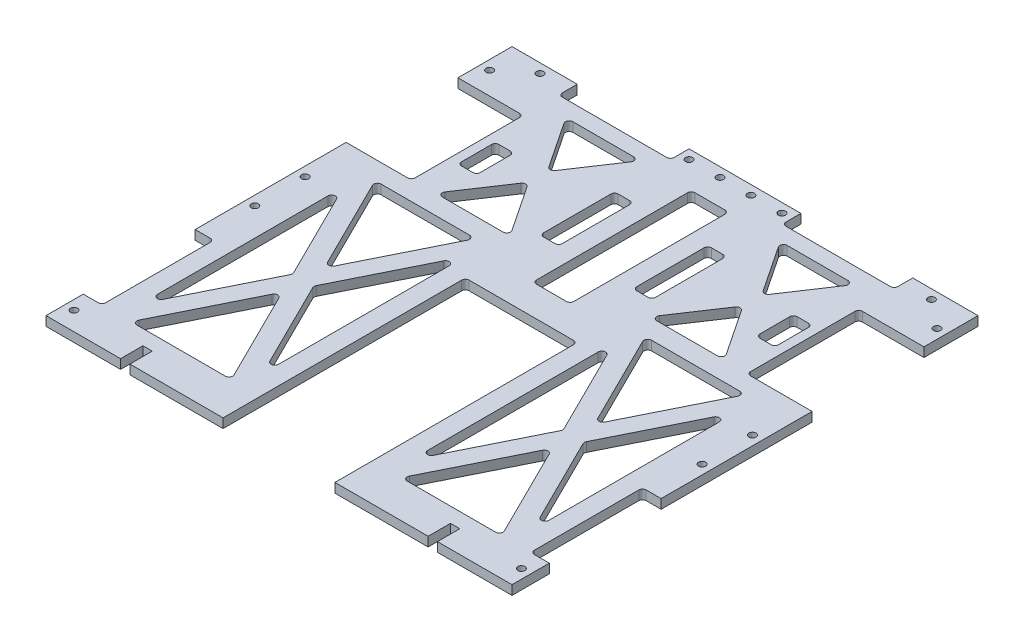
from build123d import *

# Parameters (mm, degrees)
BOSS_EXTRUDE1_DEPTH = 6.35
SKETCH2_W           = 44.45
SKETCH2_H           = 76.2
SKETCH2_W_2         = 12.7
SKETCH2_W_3         = 76.2
SKETCH2_H_2         = 12.7
CUT_EXTRUDE1_DEPTH  = 289.907554418
CUT_EXTRUDE3_DEPTH  = 289.907554418
SKETCH3_W           = 12.7
SKETCH3_H           = 50.8
SKETCH3_H_2         = 25.4
SKETCH3_W_2         = 6.35
SKETCH3_H_3         = 15.24
CUT_EXTRUDE2_DEPTH  = 289.907554418
SKETCH7_R           = 2.413
CUT_EXTRUDE6_DEPTH  = 289.907554418
SKETCH12_W          = 25.4
SKETCH12_H          = 107.95
CUT_EXTRUDE9_DEPTH  = 289.907554418
FILLET1_R           = 2.54
FILLET2_R           = 2.54
FILLET3_R           = 2.54


with BuildPart() as part:
    # Sketch1 → Boss-Extrude1 (new body)
    with BuildSketch(Plane(origin=(0, 0, 0), x_dir=(1, 0, 0), z_dir=(0, 1, 0))):
        Polygon((-158.75, 76.2), (-158.75, -241.3), (-38.1, -241.3), (-38.1, -76.2), (38.1, -76.2), (38.1, -241.3), (158.75, -241.3), (158.75, 76.2), align=None)
    extrude(amount=BOSS_EXTRUDE1_DEPTH)

    # Sketch2 → Cut-Extrude1 (cut, through all)
    with BuildSketch(Plane(origin=(0, 6.35, 0), x_dir=(1, 0, 0), z_dir=(0, 1, 0))):
        with Locations((136.525, 1.27)):
            Rectangle(SKETCH2_W, SKETCH2_H)
        with Locations((152.4, -177.8)):
            Rectangle(SKETCH2_W_2, SKETCH2_H)
        with Locations((-152.4, -177.8)):
            Rectangle(SKETCH2_W_2, SKETCH2_H)
        with Locations((-136.525, 1.27)):
            Rectangle(SKETCH2_W, SKETCH2_H)
        with Locations((-76.2, 69.85)):
            Rectangle(SKETCH2_W_3, SKETCH2_H_2)
        with Locations((76.2, 69.85)):
            Rectangle(SKETCH2_W_3, SKETCH2_H_2)
    extrude(amount=-CUT_EXTRUDE1_DEPTH, mode=Mode.SUBTRACT)

    # Sketch4 → Cut-Extrude3 (cut, through all)
    with BuildSketch(Plane(origin=(0, 6.35, 0), x_dir=(1, 0, 0), z_dir=(0, 1, 0))):
        Polygon((92.075, -147.001477117), (57.88871002, -215.9), (126.26128998, -215.9), align=None)
        Polygon((50.8, -63.816477117), (50.8, -201.613522883), (84.98628998, -132.715), align=None)
        Polygon((133.35, -63.816477117), (99.16371002, -132.715), (133.35, -201.613522883), align=None)
        Polygon((57.88871002, -49.53), (92.075, -118.428522883), (126.26128998, -49.53), align=None)
        Polygon((-84.98628998, -132.715), (-50.8, -201.613522883), (-50.8, -63.816477117), align=None)
        Polygon((-126.26128998, -49.53), (-92.075, -118.428522883), (-57.88871002, -49.53), align=None)
        Polygon((-57.88871002, -215.9), (-92.075, -147.001477117), (-126.26128998, -215.9), align=None)
        Polygon((-133.35, -201.613522883), (-99.16371002, -132.715), (-133.35, -63.816477117), align=None)
    extrude(amount=-CUT_EXTRUDE3_DEPTH, mode=Mode.SUBTRACT)

    # Sketch3 → Cut-Extrude2 (cut, through all)
    with BuildSketch(Plane(origin=(0, 6.35, 0), x_dir=(1, 0, 0), z_dir=(0, 1, 0))):
        with Locations((-31.75, 0)):
            Rectangle(SKETCH3_W, SKETCH3_H)
        with Locations((31.75, 0)):
            Rectangle(SKETCH3_W, SKETCH3_H)
        with Locations((101.6, 1.27)):
            Rectangle(SKETCH3_W, SKETCH3_H_2)
        with Locations((-101.6, 1.27)):
            Rectangle(SKETCH3_W, SKETCH3_H_2)
        with Locations((104.775, -233.68)):
            Rectangle(SKETCH3_W_2, SKETCH3_H_3)
        with Locations((-104.775, -233.68)):
            Rectangle(SKETCH3_W_2, SKETCH3_H_3)
    extrude(amount=-CUT_EXTRUDE2_DEPTH, mode=Mode.SUBTRACT)

    # Sketch7 → Cut-Extrude6 (cut, through all)
    with BuildSketch(Plane(origin=(0, 6.35, 0), x_dir=(1, 0, 0), z_dir=(0, 1, 0))):
        with Locations((152.4, -105.41)):
            Circle(SKETCH7_R)
        with Locations((152.4, -71.12)):
            Circle(SKETCH7_R)
        with Locations((152.4, -228.6)):
            Circle(SKETCH7_R)
        with Locations((133.35, 69.85)):
            Circle(SKETCH7_R)
        with Locations((152.4, 54.61)):
            Circle(SKETCH7_R)
        with Locations((-152.4, -228.6)):
            Circle(SKETCH7_R)
        with Locations((-31.75, 69.85)):
            Circle(SKETCH7_R)
        with Locations((-10.668, 69.85)):
            Circle(SKETCH7_R)
        with Locations((10.414, 69.85)):
            Circle(SKETCH7_R)
        with Locations((31.496, 69.85)):
            Circle(SKETCH7_R)
        with Locations((-152.4, 54.61)):
            Circle(SKETCH7_R)
        with Locations((-133.35, 69.85)):
            Circle(SKETCH7_R)
        with Locations((-152.4, -71.12)):
            Circle(SKETCH7_R)
        with Locations((-152.4, -105.41)):
            Circle(SKETCH7_R)
    extrude(amount=-CUT_EXTRUDE6_DEPTH, mode=Mode.SUBTRACT)

    # Sketch12 → Cut-Extrude9 (cut, through all)
    with BuildSketch(Plane(origin=(0, 6.35, 0), x_dir=(1, 0, 0), z_dir=(0, 1, 0))):
        Polygon((-98.425, 52.614228607), (-47.625, 52.614228607), (-73.025, 14.514228607), align=None)
        Polygon((-47.625, -36.285771393), (-73.025, 1.814228607), (-98.425, -36.285771393), align=None)
        Polygon((73.025, 1.814228607), (98.425, -36.285771393), (47.625, -36.285771393), align=None)
        Polygon((73.025, 14.514228607), (98.425, 52.614228607), (47.625, 52.614228607), align=None)
        with Locations((0, -1.679180184)):
            Rectangle(SKETCH12_W, SKETCH12_H)
    extrude(amount=-CUT_EXTRUDE9_DEPTH, mode=Mode.SUBTRACT)

    # Fillet1
    fillet1_edges = [part.edges().sort_by_distance(p)[0] for p in [
        (-12.7, 3.175, 55.654180184),
        (-12.7, 3.175, -52.295819816),
        (-133.35, 3.175, 63.816477117),
        (-133.35, 3.175, 201.613522883),
        (-126.26128998, 3.175, 215.9),
        (-57.88871002, 3.175, 215.9),
        (-92.075, 3.175, 147.001477117),
        (-84.98628998, 3.175, 132.715),
        (-50.8, 3.175, 63.816477117),
        (-50.8, 3.175, 201.613522883),
        (-92.075, 3.175, 118.428522883),
        (-99.16371002, 3.175, 132.715),
        (-57.88871002, 3.175, 49.53),
        (-126.26128998, 3.175, 49.53),
        (-98.425, 3.175, 36.285771393),
        (-47.625, 3.175, 36.285771393),
        (-73.025, 3.175, -1.814228607),
        (-73.025, 3.175, -14.514228607),
        (-47.625, 3.175, -52.614228607),
        (-98.425, 3.175, -52.614228607),
    ]]
    fillet(fillet1_edges, radius=FILLET1_R)

    # Fillet2
    fillet2_edges = [part.edges().sort_by_distance(p)[0] for p in [
        (50.8, 3.175, 63.816477117),
        (133.35, 3.175, 63.816477117),
        (92.075, 3.175, 147.001477117),
        (99.16371002, 3.175, 132.715),
        (50.8, 3.175, 201.613522883),
        (57.88871002, 3.175, 215.9),
        (133.35, 3.175, 201.613522883),
        (84.98628998, 3.175, 132.715),
        (126.26128998, 3.175, 215.9),
        (92.075, 3.175, 118.428522883),
        (57.88871002, 3.175, 49.53),
        (126.26128998, 3.175, 49.53),
        (73.025, 3.175, -1.814228607),
        (47.625, 3.175, 36.285771393),
        (98.425, 3.175, 36.285771393),
        (98.425, 3.175, -52.614228607),
        (73.025, 3.175, -14.514228607),
        (12.7, 3.175, 55.654180184),
        (12.7, 3.175, -52.295819816),
        (47.625, 3.175, -52.614228607),
    ]]
    fillet(fillet2_edges, radius=FILLET2_R)

    # Fillet3
    fillet3_edges = [part.edges().sort_by_distance(p)[0] for p in [
        (-107.95, 3.175, 11.43),
        (-95.25, 3.175, 11.43),
        (-95.25, 3.175, -13.97),
        (-107.95, 3.175, -13.97),
        (95.25, 3.175, 11.43),
        (107.95, 3.175, 11.43),
        (107.95, 3.175, -13.97),
        (95.25, 3.175, -13.97),
        (114.3, 3.175, -63.5),
        (38.1, 3.175, -63.5),
        (-38.1, 3.175, -63.5),
        (-114.3, 3.175, -63.5),
        (146.05, 3.175, 215.9),
        (146.05, 3.175, 139.7),
        (-146.05, 3.175, 215.9),
        (-146.05, 3.175, 139.7),
        (38.1, 3.175, 76.2),
        (-38.1, 3.175, 76.2),
        (-114.3, 3.175, 36.83),
        (-114.3, 3.175, -39.37),
        (114.3, 3.175, -39.37),
        (114.3, 3.175, 36.83),
        (-25.4, 3.175, 25.4),
        (-38.1, 3.175, 25.4),
        (-38.1, 3.175, -25.4),
        (-25.4, 3.175, -25.4),
        (25.4, 3.175, 25.4),
        (38.1, 3.175, 25.4),
        (38.1, 3.175, -25.4),
        (25.4, 3.175, -25.4),
    ]]
    fillet(fillet3_edges, radius=FILLET3_R)


solid = part.part
